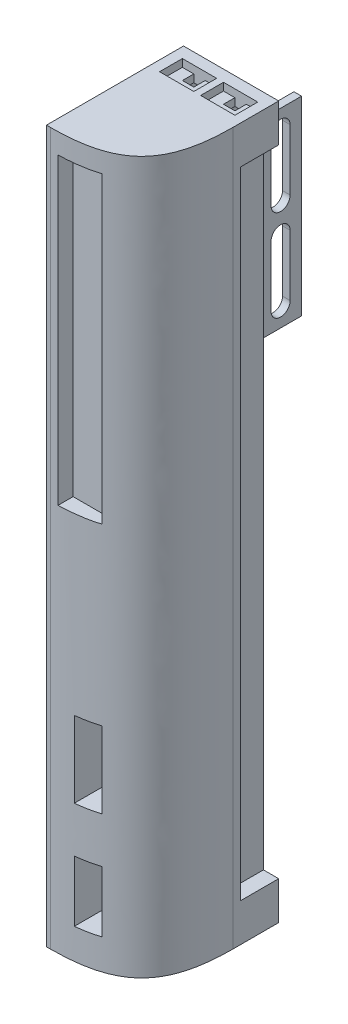
from build123d import *

# Parameters (mm, degrees)
SKETCH1_W           = 25
SKETCH1_H           = 36
BOSS_EXTRUDE1_DEPTH = 186.9
FILLET1_SIZE        = 24
SKETCH2_W           = 5
SKETCH2_H           = 10
CUT_EXTRUDE1_DEPTH  = 4
SKETCH3_W           = 8
SKETCH3_H           = 5.2
SKETCH3_H_2         = 5.6
CUT_EXTRUDE2_DEPTH  = 10
SKETCH4_W           = 41
SKETCH4_H           = 50
BOSS_EXTRUDE2_DEPTH = 2
CUT_EXTRUDE3_REACH  = 202.374
CHAMFER1_SIZE       = 16
SKETCH6_W           = 6
SKETCH6_H           = 4
CUT_EXTRUDE4_DEPTH  = 9
SKETCH7_W           = 3
SKETCH7_H           = 3
CUT_EXTRUDE5_DEPTH  = 10
BOSS_EXTRUDE3_DEPTH = 4
SKETCH9_R           = 2
CUT_EXTRUDE6_DEPTH  = 5
SKETCH10_R          = 1.5
CUT_EXTRUDE7_DEPTH  = 4
SKETCH11_W          = 6
SKETCH11_H          = 16
SKETCH11_H_2        = 20
CUT_EXTRUDE8_DEPTH  = 8
SKETCH12_W          = 10
SKETCH12_H          = 79.7
CUT_EXTRUDE9_DEPTH  = 4
SKETCH13_W          = 10
SKETCH13_H          = 166.9
CUT_EXTRUDE10_DEPTH = 4
SKETCH14_W          = 9
SKETCH14_H          = 6
CUT_EXTRUDE11_DEPTH = 2


with BuildPart() as part:
    # Sketch1 → Boss-Extrude1 (new body)
    with BuildSketch(Plane(origin=(0, 0, 0), x_dir=(1, 0, 0), z_dir=(0, 1, 0))):
        with Locations((12.5, 18)):
            Rectangle(SKETCH1_W, SKETCH1_H)
    extrude(amount=BOSS_EXTRUDE1_DEPTH)

    # Fillet1
    # a fillet whose section is not a circle: 24 mm, written as the material it takes off along each edge
    with BuildSketch(Plane(origin=(25, -60, 0), x_dir=(-1, 0, 0), z_dir=(0, 1, 0))) as fillet1_piece_1:
        with BuildLine():
            Bezier((FILLET1_SIZE, 0), (0, 0), (0, -FILLET1_SIZE), weights=[1, 1.222222222, 1])
            Line((0, -FILLET1_SIZE), (0, 0))
            Line((0, 0), (FILLET1_SIZE, 0))
        make_face()
    extrude(amount=306.9, mode=Mode.SUBTRACT)

    # Sketch2 → Cut-Extrude1 (cut)
    with BuildSketch(Plane.ZY):
        with Locations((-3.7, 78.2)):
            Rectangle(SKETCH2_W, SKETCH2_H)
    extrude(amount=-CUT_EXTRUDE1_DEPTH, mode=Mode.SUBTRACT)

    # Sketch3 → Cut-Extrude2 (cut)
    with BuildSketch(Plane.ZY):
        with Locations((-10, 30.6)):
            Rectangle(SKETCH3_W, SKETCH3_H)
        with Locations((-26, 30.6)):
            Rectangle(SKETCH3_W, SKETCH3_H)
        with Locations((-10, 64)):
            Rectangle(SKETCH3_W, SKETCH3_H_2)
        with Locations((-26, 64)):
            Rectangle(SKETCH3_W, SKETCH3_H_2)
    extrude(amount=-CUT_EXTRUDE2_DEPTH, mode=Mode.SUBTRACT)

    # Sketch4 → Boss-Extrude2 (add)
    with BuildSketch(Plane.ZY):
        with Locations((-46.5, 135)):
            Rectangle(SKETCH4_W, SKETCH4_H)
    extrude(amount=BOSS_EXTRUDE2_DEPTH)

    # Sketch5 → Cut-Extrude3 (cut, up to next)
    with BuildSketch(Plane.ZY.offset(2), mode=Mode.PRIVATE) as cut_extrude3_sk1:
        with BuildLine():
            Line((-59, 131), (-59, 115))
            ThreePointArc((-59, 115), (-61.5, 112.5), (-64, 115))
            Line((-64, 115), (-64, 131))
            ThreePointArc((-64, 131), (-61.5, 133.5), (-59, 131))
        make_face()
    cut_extrude3_tool1 = extrude(cut_extrude3_sk1.sketch, amount=-CUT_EXTRUDE3_REACH, mode=Mode.PRIVATE) & part.part
    # Sketch5 → Cut-Extrude3 (cut, up to next)
    with BuildSketch(Plane.ZY.offset(2), mode=Mode.PRIVATE) as cut_extrude3_sk2:
        with BuildLine():
            Line((-64, 139), (-64, 155))
            ThreePointArc((-64, 155), (-61.5, 157.5), (-59, 155))
            Line((-59, 155), (-59, 139))
            ThreePointArc((-59, 139), (-61.5, 136.5), (-64, 139))
        make_face()
    cut_extrude3_tool2 = extrude(cut_extrude3_sk2.sketch, amount=-CUT_EXTRUDE3_REACH, mode=Mode.PRIVATE) & part.part
    add(cut_extrude3_tool1.solids().sort_by_distance((-2, 123, -61.5))[0], mode=Mode.SUBTRACT)
    add(cut_extrude3_tool2.solids().sort_by_distance((-2, 147, -61.5))[0], mode=Mode.SUBTRACT)

    # Chamfer1
    chamfer1_edges = [part.edges().sort_by_distance(p)[0] for p in [
        (0, 135, -36),
    ]]
    chamfer(chamfer1_edges, length=CHAMFER1_SIZE)

    # Sketch6 → Cut-Extrude4 (cut)
    with BuildSketch(Plane(origin=(0, 0, -36), x_dir=(-1, 0, 0), z_dir=(0, 0, -1))):
        with Locations((-18, 180.9)):
            Rectangle(SKETCH6_W, SKETCH6_H)
        with Locations((-7.2, 180.9)):
            Rectangle(SKETCH6_W, SKETCH6_H)
    extrude(amount=-CUT_EXTRUDE4_DEPTH, mode=Mode.SUBTRACT)

    # Sketch7 → Cut-Extrude5 (cut)
    with BuildSketch(Plane(origin=(0, 186.9, 0), x_dir=(1, 0, 0), z_dir=(0, 1, 0))):
        with Locations((18, 31.5)):
            Rectangle(SKETCH7_W, SKETCH7_H)
        with Locations((7.2, 31.5)):
            Rectangle(SKETCH7_W, SKETCH7_H)
    extrude(amount=-CUT_EXTRUDE5_DEPTH, mode=Mode.SUBTRACT)

    # Sketch8 → Boss-Extrude3 (add)
    with BuildSketch(Plane.XZ):
        Polygon((3, -5), (7, -5), (7, -29), (21, -29), (21, -33), (7, -33), (3, -33), align=None)
    extrude(amount=BOSS_EXTRUDE3_DEPTH)

    # Sketch9 → Cut-Extrude6 (cut)
    with BuildSketch(Plane.XZ):
        with Locations(Location((14, -22, 0), (0, 0, 270))):
            Circle(SKETCH9_R)
    extrude(amount=-CUT_EXTRUDE6_DEPTH, mode=Mode.SUBTRACT)

    # Sketch10 → Cut-Extrude7 (cut)
    with BuildSketch(Plane.XZ):
        with Locations(Location((14, -12, 0), (0, 0, 270))):
            Circle(SKETCH10_R)
    extrude(amount=-CUT_EXTRUDE7_DEPTH, mode=Mode.SUBTRACT)

    # Sketch11 → Cut-Extrude8 (cut)
    with BuildSketch(Plane.XY):
        with Locations((10, 16)):
            Rectangle(SKETCH11_W, SKETCH11_H)
        with Locations((10, 46)):
            Rectangle(SKETCH11_W, SKETCH11_H_2)
    extrude(amount=-CUT_EXTRUDE8_DEPTH, mode=Mode.SUBTRACT)

    # Sketch12 → Cut-Extrude9 (cut)
    with BuildSketch(Plane.XY):
        with Locations((8, 141.75)):
            Rectangle(SKETCH12_W, SKETCH12_H)
    extrude(amount=-CUT_EXTRUDE9_DEPTH, mode=Mode.SUBTRACT)

    # Sketch13 → Cut-Extrude10 (cut)
    with BuildSketch(Plane(origin=(25, 0, 0), x_dir=(0, 0, -1), z_dir=(1, 0, 0))):
        with Locations((31, 93.45)):
            Rectangle(SKETCH13_W, SKETCH13_H)
    extrude(amount=-CUT_EXTRUDE10_DEPTH, mode=Mode.SUBTRACT)

    # Sketch14 → Cut-Extrude11 (cut)
    with BuildSketch(Plane(origin=(0, 186.9, 0), x_dir=(1, 0, 0), z_dir=(0, 1, 0))):
        with Locations((7.2, 30)):
            Rectangle(SKETCH14_W, SKETCH14_H)
        with Locations((18, 30)):
            Rectangle(SKETCH14_W, SKETCH14_H)
    extrude(amount=-CUT_EXTRUDE11_DEPTH, mode=Mode.SUBTRACT)


solid = part.part
